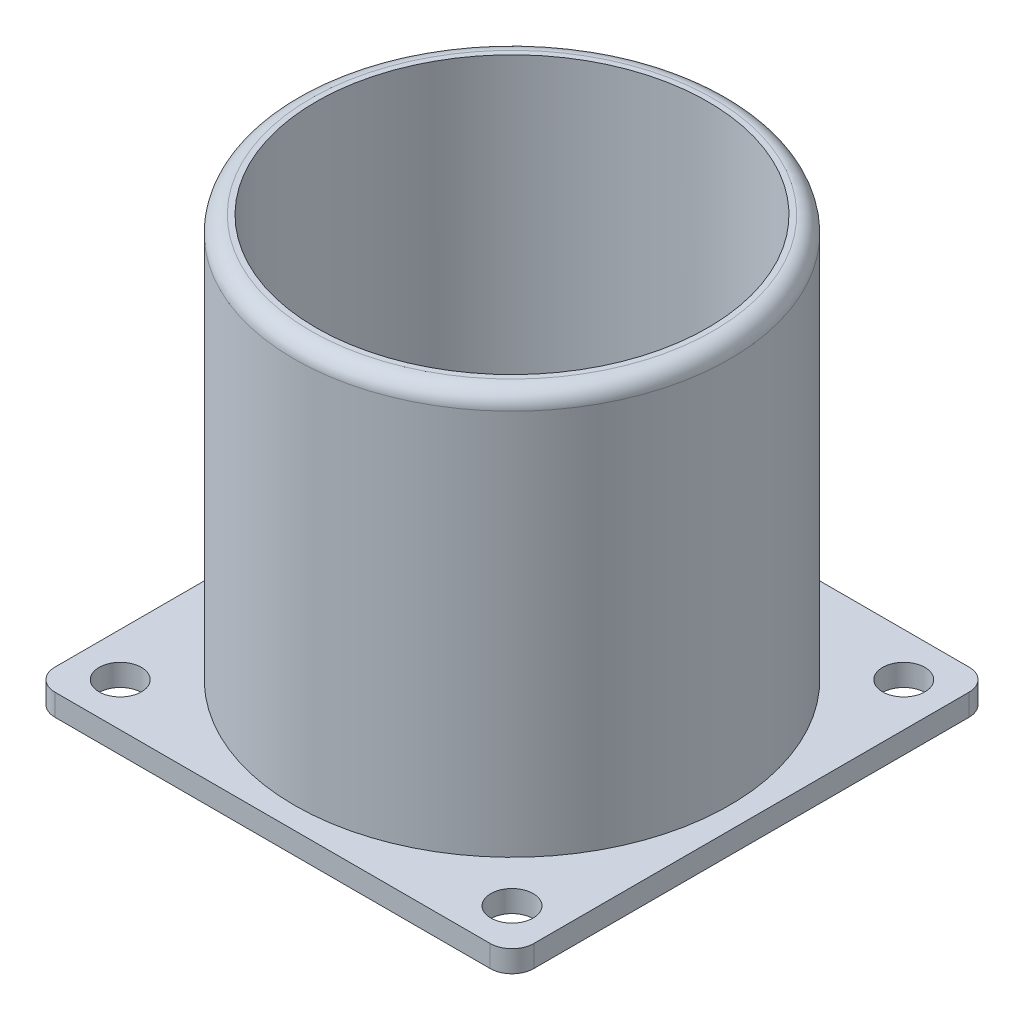
from build123d import *
from build123d.topology import SkipClean

# Parameters (mm, degrees)
ESBO_O1_W                = 44
ESBO_O1_H                = 44
RESSALTO_EXTRUS_O1_DEPTH = 2
ESBO_O3_R                = 20
ESBO_O3_R_2              = 18
RESSALTO_EXTRUS_O3_DEPTH = 37
FILETE3_R                = 1.5
FILETE4_R                = 2


with BuildPart() as part:
    # Esboço1 → Ressalto-extrusão1 (new body)
    with BuildSketch(Plane(origin=(0, 0, 0), x_dir=(1, 0, 0), z_dir=(0, 1, 0))):
        Rectangle(ESBO_O1_W, ESBO_O1_H)
        with BuildLine():
            ThreePointArc((-16.05, -18), (-19.622498074, -19.081665383), (-17.25, -16.2))
            ThreePointArc((-17.25, -16.2), (-16.377501926, -16.918334617), (-16.05, -18))
        make_face(mode=Mode.SUBTRACT)
        with BuildLine():
            ThreePointArc((-3.75, -17.605041891), (-4.50417298, -17.427347066), (-5.25, -17.217360425))
            Line((-5.25, -17.217360425), (-5.25, 17.217360425))
            ThreePointArc((-5.25, 17.217360425), (-4.50417298, 17.427347066), (-3.75, 17.605041891))
            Line((-3.75, 17.605041891), (-3.75, -17.605041891))
        make_face(mode=Mode.SUBTRACT)
        with BuildLine():
            ThreePointArc((19.95, -18), (16.918334617, -19.622498074), (17.25, -16.2))
            ThreePointArc((17.25, -16.2), (19.081665383, -16.377501926), (19.95, -18))
        make_face(mode=Mode.SUBTRACT)
        with BuildLine():
            ThreePointArc((-15.75, -8.714212529), (-16.596404379, -6.968454757), (-17.25, -5.14174095))
            Line((-17.25, -5.14174095), (-17.25, 5.14174095))
            ThreePointArc((-17.25, 5.14174095), (-16.596404379, 6.968454757), (-15.75, 8.714212529))
            Line((-15.75, 8.714212529), (-15.75, -8.714212529))
        make_face(mode=Mode.SUBTRACT)
        with BuildLine():
            ThreePointArc((-12.75, -12.70580576), (-13.527005163, -11.875189739), (-14.25, -10.997158724))
            Line((-14.25, -10.997158724), (-14.25, 10.997158724))
            ThreePointArc((-14.25, 10.997158724), (-13.527005163, 11.875189739), (-12.75, 12.70580576))
            Line((-12.75, 12.70580576), (-12.75, -12.70580576))
        make_face(mode=Mode.SUBTRACT)
        with BuildLine():
            ThreePointArc((-9.75, -15.130680751), (-10.513862046, -14.610226038), (-11.25, -14.051245496))
            Line((-11.25, -14.051245496), (-11.25, 14.051245496))
            ThreePointArc((-11.25, 14.051245496), (-10.513862046, 14.610226038), (-9.75, 15.130680751))
            Line((-9.75, 15.130680751), (-9.75, -15.130680751))
        make_face(mode=Mode.SUBTRACT)
        with BuildLine():
            ThreePointArc((-6.75, -16.686446596), (-7.507894085, -16.359447619), (-8.25, -15.998046756))
            Line((-8.25, -15.998046756), (-8.25, 15.998046756))
            ThreePointArc((-8.25, 15.998046756), (-7.507894085, 16.359447619), (-6.75, 16.686446596))
            Line((-6.75, 16.686446596), (-6.75, -16.686446596))
        make_face(mode=Mode.SUBTRACT)
        with BuildLine():
            Line((-0.75, 17.984368212), (-0.75, -17.984368212))
            ThreePointArc((-0.75, -17.984368212), (-1.501312927, -17.937281274), (-2.25, -17.85882135))
            Line((-2.25, -17.85882135), (-2.25, 17.85882135))
            ThreePointArc((-2.25, 17.85882135), (-1.501312927, 17.937281274), (-0.75, 17.984368212))
        make_face(mode=Mode.SUBTRACT)
        with BuildLine():
            ThreePointArc((-16.05, 18), (-16.377501926, 16.918334617), (-17.25, 16.2))
            ThreePointArc((-17.25, 16.2), (-19.622498074, 19.081665383), (-16.05, 18))
        make_face(mode=Mode.SUBTRACT)
        with BuildLine():
            ThreePointArc((2.25, -17.85882135), (1.501312927, -17.937281274), (0.75, -17.984368212))
            Line((0.75, -17.984368212), (0.75, 17.984368212))
            ThreePointArc((0.75, 17.984368212), (1.501312927, 17.937281274), (2.25, 17.85882135))
            Line((2.25, 17.85882135), (2.25, -17.85882135))
        make_face(mode=Mode.SUBTRACT)
        with BuildLine():
            ThreePointArc((5.25, -17.217360425), (4.50417298, -17.427347066), (3.75, -17.605041891))
            Line((3.75, -17.605041891), (3.75, 17.605041891))
            ThreePointArc((3.75, 17.605041891), (4.50417298, 17.427347066), (5.25, 17.217360425))
            Line((5.25, 17.217360425), (5.25, -17.217360425))
        make_face(mode=Mode.SUBTRACT)
        with BuildLine():
            ThreePointArc((8.25, -15.998046756), (7.507894085, -16.359447619), (6.75, -16.686446596))
            Line((6.75, -16.686446596), (6.75, 16.686446596))
            ThreePointArc((6.75, 16.686446596), (7.507894085, 16.359447619), (8.25, 15.998046756))
            Line((8.25, 15.998046756), (8.25, -15.998046756))
        make_face(mode=Mode.SUBTRACT)
        with BuildLine():
            ThreePointArc((11.25, -14.051245496), (10.513862046, -14.610226038), (9.75, -15.130680751))
            Line((9.75, -15.130680751), (9.75, 15.130680751))
            ThreePointArc((9.75, 15.130680751), (10.513862046, 14.610226038), (11.25, 14.051245496))
            Line((11.25, 14.051245496), (11.25, -14.051245496))
        make_face(mode=Mode.SUBTRACT)
        with BuildLine():
            ThreePointArc((14.25, -10.997158724), (13.527005163, -11.875189739), (12.75, -12.70580576))
            Line((12.75, -12.70580576), (12.75, 12.70580576))
            ThreePointArc((12.75, 12.70580576), (13.527005163, 11.875189739), (14.25, 10.997158724))
            Line((14.25, 10.997158724), (14.25, -10.997158724))
        make_face(mode=Mode.SUBTRACT)
        with BuildLine():
            ThreePointArc((17.25, -5.14174095), (16.596404379, -6.968454757), (15.75, -8.714212529))
            Line((15.75, -8.714212529), (15.75, 8.714212529))
            ThreePointArc((15.75, 8.714212529), (16.596404379, 6.968454757), (17.25, 5.14174095))
            Line((17.25, 5.14174095), (17.25, -5.14174095))
        make_face(mode=Mode.SUBTRACT)
        with BuildLine():
            ThreePointArc((19.95, 18), (19.081665383, 16.377501926), (17.25, 16.2))
            ThreePointArc((17.25, 16.2), (16.918334617, 19.622498074), (19.95, 18))
        make_face(mode=Mode.SUBTRACT)
    extrude(amount=RESSALTO_EXTRUS_O1_DEPTH)

    # Esboço3 → Ressalto-extrusão3 (add)
    with SkipClean():  # the faces are left unmerged after this step: merging them gives an invalid solid
        with BuildSketch(Plane(origin=(0, 2, 0), x_dir=(1, 0, 0), z_dir=(0, 1, 0))):
            Circle(ESBO_O3_R)
            Circle(ESBO_O3_R_2, mode=Mode.SUBTRACT)
        extrude(amount=RESSALTO_EXTRUS_O3_DEPTH)

    # Filete3
    filete3_edges = [part.edges().sort_by_distance(p)[0] for p in [
        (-20, 39, 0),
    ]]
    fillet(filete3_edges, radius=FILETE3_R)

    # Filete4
    filete4_edges = [part.edges().sort_by_distance(p)[0] for p in [
        (-22, 1, -22),
        (-22, 1, 22),
        (22, 1, 22),
        (22, 1, -22),
    ]]
    fillet(filete4_edges, radius=FILETE4_R)


solid = part.part
